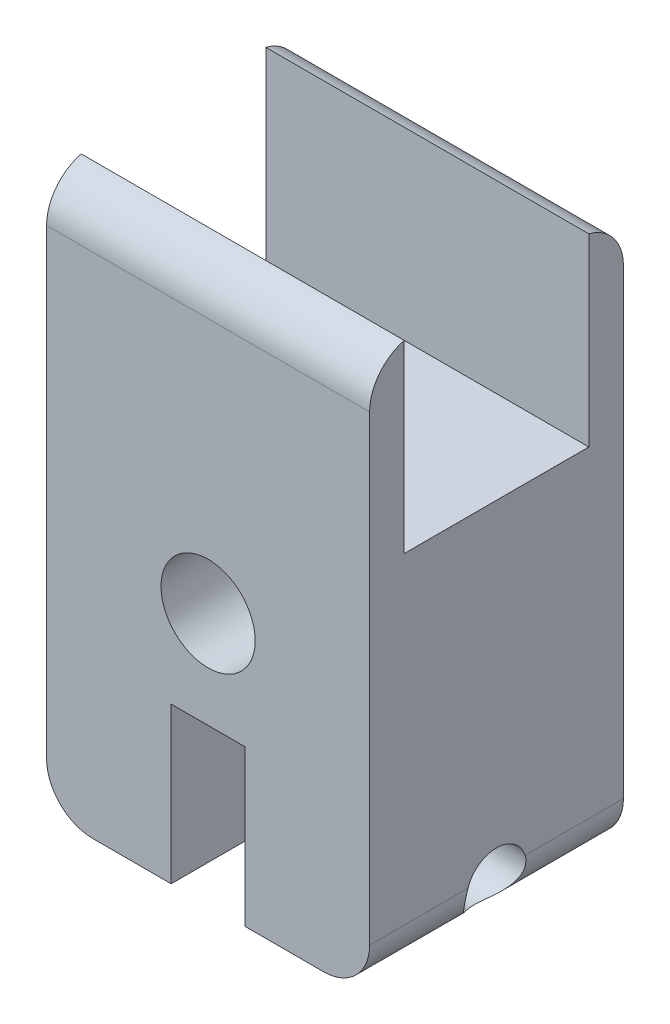
from build123d import *

# Parameters (mm, degrees)
CROQUIS1_W              = 35
CROQUIS1_H              = 35
CROQUIS1_R              = 11
ENTRADABASE_DEPTH       = 3.5
CROQUIS2_W              = 35
CROQUIS2_H              = 35
CROQUIS2_R              = 5.1
ENTRADACAVIDAD_DEPTH    = 24
REDONDEO1_R             = 5
CROQUIS4_W              = 27.5
CROQUIS4_H              = 14.86
CROQUIS4_R              = 3.25
BARRENORODAMIENTO_DEPTH = 35
CROQUIS5_W              = 8
CROQUIS5_H              = 16.86
ENTRADARODAMIENTO_DEPTH = 64.195487181
DETALLE2_R              = 5
CROQUIS10_W             = 3.75
CROQUIS10_H             = 15
SALIENTE_EXTRUIR4_DEPTH = 35
REDONDEO5_R             = 5
CROQUIS11_W             = 20
CROQUIS11_H             = 20
CORTAR_EXTRUIR5_DEPTH   = 64.195487351


with BuildPart() as part:
    # Croquis1 → EntradaBase (new body)
    with BuildSketch(Plane.XY):
        with Locations((17.5, -17.5)):
            Rectangle(CROQUIS1_W, CROQUIS1_H)
        with Locations((17.5, -17.5)):
            Circle(CROQUIS1_R, mode=Mode.SUBTRACT)
    extrude(amount=ENTRADABASE_DEPTH)

    # Croquis2 → EntradaCavidad (add)
    with BuildSketch(Plane.XY.offset(3.5)):
        with Locations((17.5, -17.5)):
            Rectangle(CROQUIS2_W, CROQUIS2_H)
        with Locations((17.5, -17.5)):
            Circle(CROQUIS2_R, mode=Mode.SUBTRACT)
    extrude(amount=ENTRADACAVIDAD_DEPTH)

    # Redondeo1
    redondeo1_edges = [part.edges().sort_by_distance(p)[0] for p in [
        (35, -35, 13.75),
        (0, -35, 13.75),
    ]]
    fillet(redondeo1_edges, radius=REDONDEO1_R)

    # Croquis4 → BarrenoRodamiento (add, through all)
    with BuildSketch(Plane.ZY):
        with Locations((13.75, -37.43)):
            Rectangle(CROQUIS4_W, CROQUIS4_H)
        with Locations(Location((13.75, -40.86, 0), (0, 0, 270))):
            Circle(CROQUIS4_R, mode=Mode.SUBTRACT)
    extrude(amount=-BARRENORODAMIENTO_DEPTH)

    # Croquis5 → EntradaRodamiento (cut, through all)
    with BuildSketch(Plane(origin=(0, 0, 0), x_dir=(-1, 0, 0), z_dir=(0, 0, -1))):
        with Locations((-17.5, -36.43)):
            Rectangle(CROQUIS5_W, CROQUIS5_H)
    extrude(amount=-ENTRADARODAMIENTO_DEPTH, mode=Mode.SUBTRACT)

    # Detalle2
    # the kernel refuses this fillet: 5 mm, written as the material it takes off along each edge
    with BuildSketch(Plane(origin=(35, -44.86, -12.5), x_dir=(-1, 0, 0), z_dir=(0, 0, 1))) as detalle2_piece_1:
        with BuildLine():
            CenterArc((DETALLE2_R, -DETALLE2_R), DETALLE2_R, 90, 90)
            Line((0, -DETALLE2_R), (0, 0))
            Line((0, 0), (DETALLE2_R, 0))
        make_face()
    extrude(amount=52.5, mode=Mode.SUBTRACT)
    with BuildSketch(Plane(origin=(0, -44.86, -12.5), x_dir=(1, 0, 0), z_dir=(0, 0, 1))) as detalle2_piece_2:
        with BuildLine():
            CenterArc((DETALLE2_R, DETALLE2_R), DETALLE2_R, 180, 90)
            Line((0, DETALLE2_R), (0, 0))
            Line((0, 0), (DETALLE2_R, 0))
        make_face()
    extrude(amount=52.5, mode=Mode.SUBTRACT)

    # Croquis10 → Saliente-Extruir4 (add, through all)
    with BuildSketch(Plane.ZY):
        with Locations((1.875, 7.5)):
            Rectangle(CROQUIS10_W, CROQUIS10_H)
        with Locations((25.625, 7.5)):
            Rectangle(CROQUIS10_W, CROQUIS10_H)
    extrude(amount=-SALIENTE_EXTRUIR4_DEPTH)

    # Redondeo5
    # the kernel refuses this fillet: 5 mm, written as the material it takes off along each edge
    with BuildSketch(Plane(origin=(-12.103072957, 15, 0), x_dir=(0, -1, 0), z_dir=(1, 0, 0))) as redondeo5_piece_1:
        with BuildLine():
            CenterArc((4.841229183, -5), REDONDEO5_R, 90, 75.522487814)
            Line((0, -3.75), (-0.096824584, -3.725))
            ThreePointArc((-0.096824584, -3.725), (-0.1, -1.875), (-0.1, 0))
            Line((-0.1, 0), (0, 0.1))
            Line((0, 0.1), (4.841229183, 0.1))
            Line((4.841229183, 0.1), (4.841229183, 0))
        make_face()
    extrude(amount=59.206145914, mode=Mode.SUBTRACT)
    with BuildSketch(Plane(origin=(-12.103072957, 15, 27.5), x_dir=(0, -1, 0), z_dir=(1, 0, 0))) as redondeo5_piece_2:
        with BuildLine():
            CenterArc((4.841229183, 5), REDONDEO5_R, 194.477512186, 75.522487814)
            Line((0, 3.75), (-0.096824584, 3.725))
            ThreePointArc((-0.096824584, 3.725), (-0.1, 1.875), (-0.1, 0))
            Line((-0.1, 0), (0, -0.1))
            Line((0, -0.1), (4.841229183, -0.1))
            Line((4.841229183, -0.1), (4.841229183, 0))
        make_face()
    extrude(amount=59.206145914, mode=Mode.SUBTRACT)

    # Croquis11 → Cortar-Extruir5 (cut, through all)
    with BuildSketch(Plane.ZY):
        with Locations((13.75, 5)):
            Rectangle(CROQUIS11_W, CROQUIS11_H)
    extrude(amount=-CORTAR_EXTRUIR5_DEPTH, mode=Mode.SUBTRACT)


solid = part.part
